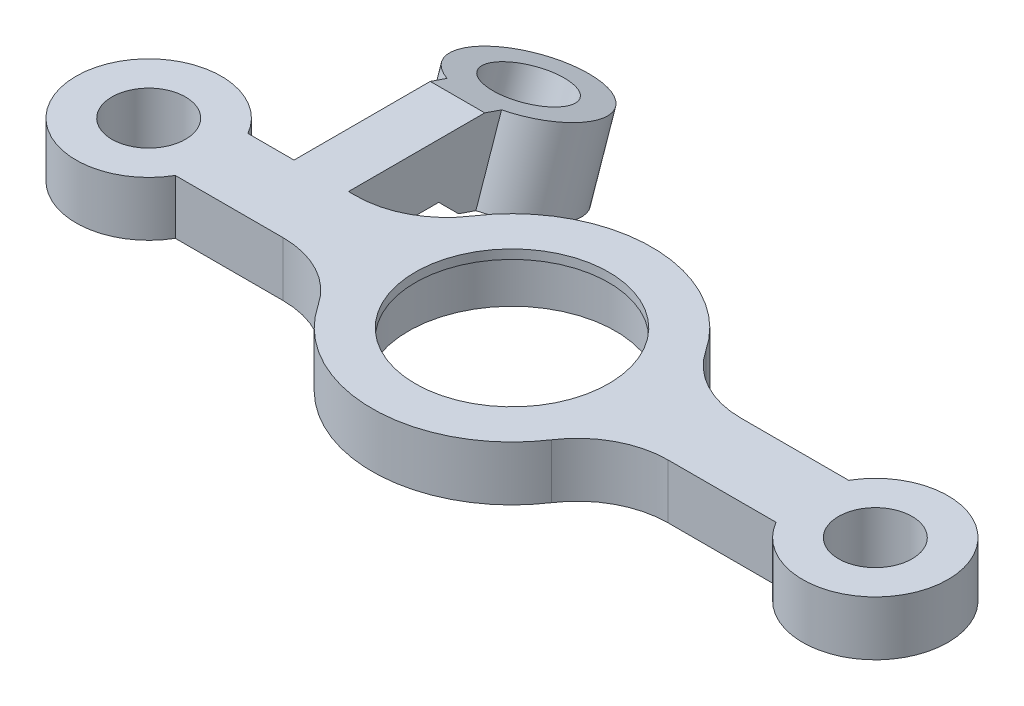
from build123d import *

# Parameters (mm, degrees)
ESBO_O1_R                     = 4.05
ESBO_O1_R_2                   = 11.4
RESSALTO_EXTRUS_O1_DEPTH      = 6
RESSALTO_EXTRUS_O2_START      = -1
ESBO_O2_R                     = 11.4
ESBO_O2_R_2                   = 10.65
RESSALTO_EXTRUS_O2_DEPTH      = 1
RESSALTO_EXTRUS_O4_DEPTH      = 3
RESSALTO_EXTRUS_O4_DEPTH_BACK = 5.673111
ESBO_O4_R                     = 4.15
CHANFRO1_SIZE                 = 2.360185131
CHANFRO1_SIZE_2               = 3


with BuildPart() as part:
    # Esboço1 → Ressalto-extrusão1 (new body)
    with BuildSketch(Plane(origin=(0, 0, 0), x_dir=(1, 0, 0), z_dir=(0, 1, 0))):
        with BuildLine():
            Line((-33.07179677, 4), (-28, 4))
            Line((-28, 4), (-28, 19))
            Line((-28, 19), (-22, 19))
            Line((-22, 19), (-22, 4))
            Line((-22, 4), (-21.193395198, 4))
            ThreePointArc((-21.193395198, 4), (-16.456207753, 5.193238103), (-12.849538821, 8.488188976))
            ThreePointArc((-12.849538821, 8.488188976), (0, 15.4), (12.849538821, 8.488188976))
            ThreePointArc((12.849538821, 8.488188976), (16.456207753, 5.193238103), (21.193395198, 4))
            Line((21.193395198, 4), (33.07179677, 4))
            ThreePointArc((33.07179677, 4), (48, 0), (33.07179677, -4))
            Line((33.07179677, -4), (21.193395198, -4))
            ThreePointArc((21.193395198, -4), (16.456207753, -5.193238103), (12.849538821, -8.488188976))
            ThreePointArc((12.849538821, -8.488188976), (0, -15.4), (-12.849538821, -8.488188976))
            ThreePointArc((-12.849538821, -8.488188976), (-16.456207753, -5.193238103), (-21.193395198, -4))
            Line((-21.193395198, -4), (-33.07179677, -4))
            ThreePointArc((-33.07179677, -4), (-48, 0), (-33.07179677, 4))
        make_face()
        with Locations(Location((40, 0, 0), (0, 0, 270))):
            Circle(ESBO_O1_R, mode=Mode.SUBTRACT)
        with Locations(Location((-40, 0, 0), (0, 0, 270))):
            Circle(ESBO_O1_R, mode=Mode.SUBTRACT)
        with Locations(Location((0, 0, 0), (0, 0, 270))):
            Circle(ESBO_O1_R_2, mode=Mode.SUBTRACT)
    extrude(amount=RESSALTO_EXTRUS_O1_DEPTH)

    # Esboço2 → Ressalto-extrusão2 (add)
    with BuildSketch(Plane(origin=(0, 6, 0), x_dir=(1, 0, 0), z_dir=(0, 1, 0)).offset(RESSALTO_EXTRUS_O2_START)):
        with Locations(Location((0, 0, 0), (0, 0, 270))):
            Circle(ESBO_O2_R)
        with Locations(Location((0, 0, 0), (0, 0, 270))):
            Circle(ESBO_O2_R_2, mode=Mode.SUBTRACT)
    extrude(amount=RESSALTO_EXTRUS_O2_DEPTH)

    # Esboço4 → Ressalto-extrusão4 (add, two sides: drawn at the far end of the back side and taken through both)
    with BuildSketch(Plane(origin=(0, 5.848784016, -2.013897841), x_dir=(-1, 0, 0), z_dir=(0, -0.9455185755993178, 0.32556815445715404)).offset(-RESSALTO_EXTRUS_O4_DEPTH_BACK)):
        with BuildLine():
            Line((28, 16.01144401), (22, 16.01144401))
            Line((22, 16.01144401), (22, 17.964852936))
            ThreePointArc((22, 17.964852936), (25, 31.289408257), (28, 17.964852936))
            Line((28, 17.964852936), (28, 16.01144401))
        make_face()
        with Locations(Location((25, 24.289408257, 0), (0, 0, 90))):
            Circle(ESBO_O4_R, mode=Mode.SUBTRACT)
    extrude(amount=RESSALTO_EXTRUS_O4_DEPTH + RESSALTO_EXTRUS_O4_DEPTH_BACK)

    # Chanfro1
    # the kernel refuses this chamfer: 3, 2.360185131 mm, written as the material it adds along each edge
    with BuildSketch(Plane(origin=(-22, 0, -16.93403432), x_dir=(0, -0.9591141724296175, 0.28301944146056485), z_dir=(-1, 0, 0))) as chanfro1_piece_1_section:
        Polygon((CHANFRO1_SIZE * 0.999002383221, CHANFRO1_SIZE * 0.0446568918676), (CHANFRO1_SIZE_2 * 0.283019441461, CHANFRO1_SIZE_2 * 0.95911417243), (0, 0), align=None)
    chanfro1_piece_1 = extrude(amount=6, mode=Mode.PRIVATE)
    chanfro1_piece_1 = split(chanfro1_piece_1, bisect_by=Plane(origin=(-25, -1.892415704, -15.281313813), z_dir=(0, 0.9455185755993178, -0.32556815445715404)), keep=Keep.TOP, mode=Mode.PRIVATE)
    add(chanfro1_piece_1)


solid = part.part
